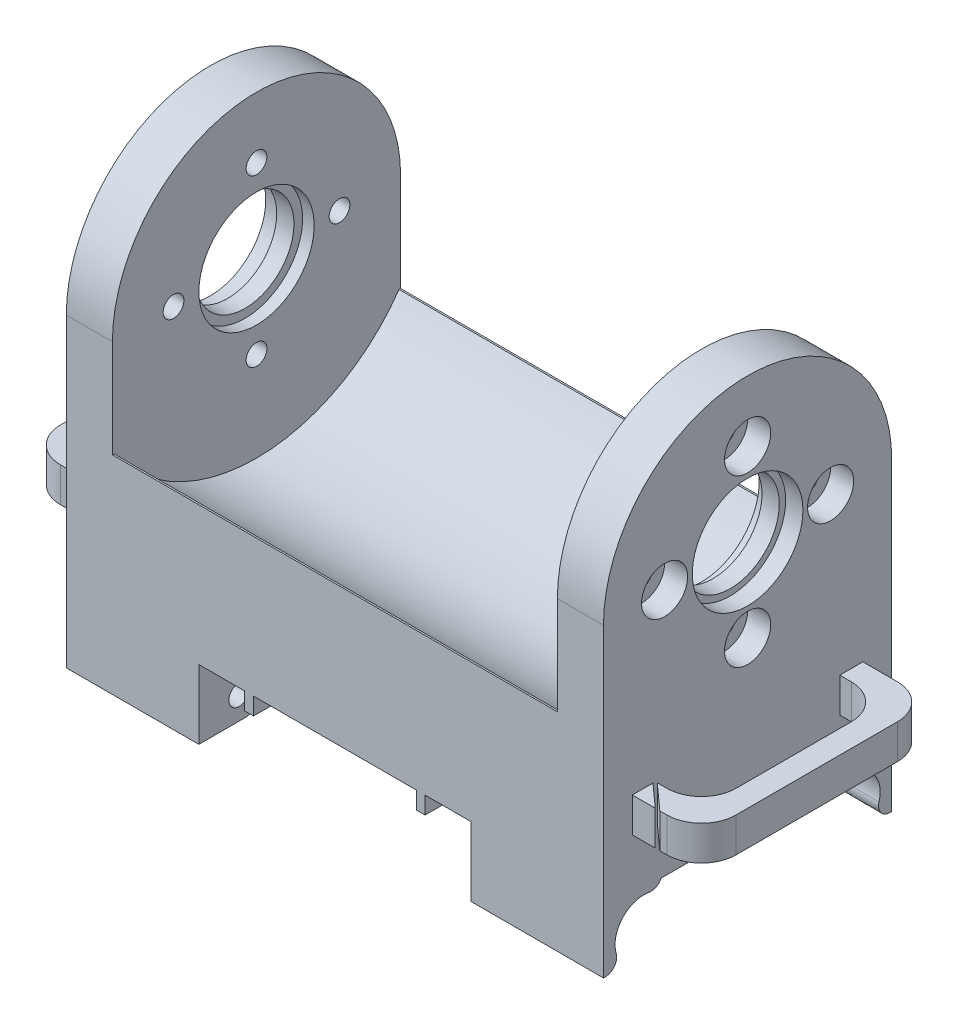
from build123d import *

# Parameters (mm, degrees)
BOSS_EXTRUDE1_DEPTH     = 4
SKETCH3_W               = 25
SKETCH3_H               = 12
BOSS_EXTRUDE2_DEPTH     = 19.3
FILLET1_RADIUS          = 12.5
FILLET1_LENGTH          = 4
CUT_EXTRUDE1_REACH      = 38.232
SKETCH4_R               = 15
CUT_EXTRUDE2_REACH      = 40.512
SKETCH5_R               = 4.25
SKETCH6_R               = 4.8
CUT_EXTRUDE3_DEPTH      = 1.5
SKETCH7_R               = 5
CUT_EXTRUDE4_DEPTH      = 1
CUT_EXTRUDE5_REACH      = 40.512
SKETCH8_R               = 0.9
CIRPATTERN1_COUNT       = 4
SKETCH10_R              = 2
CUT_EXTRUDE6_DEPTH      = 2
CIRPATTERN2_COUNT       = 4
CUT_EXTRUDE7_DEPTH      = 39.511556707
CUT_EXTRUDE7_DEPTH_BACK = 39.511556707
SKETCH11_R              = 0.9
SKETCH12_R              = 2.5
CUT_EXTRUDE8_DEPTH      = 11.5
SKETCH13_W              = 0.761046754
SKETCH13_H              = 25
BOSS_EXTRUDE3_DEPTH     = 1.5
SKETCH14_W              = 20
SKETCH14_H              = 3
BOSS_EXTRUDE4_DEPTH     = 6
FILLET4_R               = 3
SKETCH15_W              = 4
SKETCH15_H              = 16
CUT_EXTRUDE9_DEPTH      = 5
FILLET5_R               = 3
CUT_EXTRUDE10_DEPTH     = 5
SKETCH19_W              = 7.5
SKETCH19_H              = 25
BOSS_EXTRUDE5_DEPTH     = 6
SKETCH21_R              = 0.9
CUT_EXTRUDE11_DEPTH     = 58.464858827
SKETCH22_W              = 15
SKETCH22_H              = 5
CUT_EXTRUDE12_DEPTH     = 58.464858827
SKETCH23_R              = 2.5
CUT_EXTRUDE13_DEPTH     = 6
SKETCH24_R              = 2.5
CUT_EXTRUDE14_DEPTH     = 6
FILLET6_START           = -44
FILLET6_DEPTH           = 11.4
FILLET6_START_2         = -6
FILLET6_2_DEPTH         = 11
FILLET6_START_3         = -32.6
FILLET6_3_DEPTH         = 26.6


with BuildPart() as part:
    # Boss-Extrude1: read off the stored shape, not the designer's step
    # Boss-Extrude1 outline → Boss-Extrude1 (new body)
    with BuildSketch(Plane(origin=(0, 0, 0), x_dir=(0, 0, -1), z_dir=(1, 0, 0))):
        Polygon((-12.5, 28), (-12.5, -11), (-7.5, -11), (-7.5, -6), (7.5, -6), (7.5, -11), (12.5, -11), (12.5, 28), align=None)
    extrude(amount=BOSS_EXTRUDE1_DEPTH)

    # Sketch3 → Boss-Extrude2 (add)
    with BuildSketch(Plane.ZY):
        with Locations((0, 1)):
            Rectangle(SKETCH3_W, SKETCH3_H)
    extrude(amount=BOSS_EXTRUDE2_DEPTH)

    # Fillet1: full round fillet: the end face becomes a half cylinder, R = half its width
    fillet1_face = Plane((2, 28, 0), x_dir=(1, 0, 0), z_dir=(0, 1, 0))  # on the end face: x along it, z out of the body
    fillet1_slab = fillet1_face.offset(-FILLET1_RADIUS / 2) * Box(FILLET1_LENGTH, 2 * FILLET1_RADIUS, FILLET1_RADIUS, mode=Mode.PRIVATE)  # the body's end, R deep
    fillet1_round = Plane((2, 15.5, 0), x_dir=(0, 1, 0), z_dir=(1, 0, 0)) * Cylinder(FILLET1_RADIUS, FILLET1_LENGTH, mode=Mode.PRIVATE)  # its axis R under the face
    add(fillet1_slab - fillet1_round, mode=Mode.SUBTRACT)

    # Sketch4 → Cut-Extrude1 (cut, up to next)
    with BuildSketch(Plane.ZY, mode=Mode.PRIVATE) as cut_extrude1_sk1:
        with Locations((0, 15.5)):
            Circle(SKETCH4_R)
    cut_extrude1_tool1 = extrude(cut_extrude1_sk1.sketch, amount=CUT_EXTRUDE1_REACH, mode=Mode.PRIVATE) & part.part
    add(cut_extrude1_tool1.solids().sort_by_distance((0, 15.5, 0))[0], mode=Mode.SUBTRACT)

    # Sketch5 → Cut-Extrude2 (cut, up to next)
    with BuildSketch(Plane(origin=(4, 0, 0), x_dir=(0, 0, -1), z_dir=(1, 0, 0)), mode=Mode.PRIVATE) as cut_extrude2_sk1:
        with Locations((0, 15.5)):
            Circle(SKETCH5_R)
    cut_extrude2_tool1 = extrude(cut_extrude2_sk1.sketch, amount=-CUT_EXTRUDE2_REACH, mode=Mode.PRIVATE) & part.part
    add(cut_extrude2_tool1.solids().sort_by_distance((4, 15.5, 0))[0], mode=Mode.SUBTRACT)

    # Sketch6 → Cut-Extrude3 (cut)
    with BuildSketch(Plane(origin=(4, 0, 0), x_dir=(0, 0, -1), z_dir=(1, 0, 0))):
        with Locations((0, 15.5)):
            Circle(SKETCH6_R)
    extrude(amount=-CUT_EXTRUDE3_DEPTH, mode=Mode.SUBTRACT)

    # Sketch7 → Cut-Extrude4 (cut)
    with BuildSketch(Plane.ZY):
        with Locations((0, 15.5)):
            Circle(SKETCH7_R)
    extrude(amount=-CUT_EXTRUDE4_DEPTH, mode=Mode.SUBTRACT)

    # Sketch8 → Cut-Extrude5 (cut, up to next)
    with BuildSketch(Plane(origin=(4, 0, 0), x_dir=(0, 0, -1), z_dir=(1, 0, 0)), mode=Mode.PRIVATE) as cut_extrude5_sk1:
        with Locations((0, 22.7)):
            Circle(SKETCH8_R)
    cut_extrude5_tool1 = extrude(cut_extrude5_sk1.sketch, amount=-CUT_EXTRUDE5_REACH, mode=Mode.PRIVATE) & part.part
    cut_extrude5 = cut_extrude5_tool1.solids().sort_by_distance((4, 22.7, 0))[0]
    add(cut_extrude5, mode=Mode.SUBTRACT)

    # CirPattern1: Cut-Extrude5 ×4 about axis
    cirpattern1_axis = Axis((0, 15.5, 0), (1, 0, 0))
    for i in range(1, CIRPATTERN1_COUNT):
        add(cut_extrude5.rotate(cirpattern1_axis, i * 360 / CIRPATTERN1_COUNT), mode=Mode.SUBTRACT)

    # Sketch10 → Cut-Extrude6 (cut)
    with BuildSketch(Plane(origin=(4, 0, 0), x_dir=(0, 0, -1), z_dir=(1, 0, 0))):
        with Locations((0, 22.7)):
            Circle(SKETCH10_R)
    cut_extrude6 = extrude(amount=-CUT_EXTRUDE6_DEPTH, mode=Mode.SUBTRACT)

    # CirPattern2: Cut-Extrude6 ×4 about axis
    cirpattern2_axis = Axis((0, 15.5, 0), (1, 0, 0))
    for i in range(1, CIRPATTERN2_COUNT):
        add(cut_extrude6.rotate(cirpattern2_axis, i * 360 / CIRPATTERN2_COUNT), mode=Mode.SUBTRACT)

    # Sketch11 → Cut-Extrude7 (cut, two sides: drawn at the far end of the back side and taken through both)
    with BuildSketch(Plane(origin=(4, 0, 0), x_dir=(0, 0, -1), z_dir=(1, 0, 0)).offset(-CUT_EXTRUDE7_DEPTH_BACK)):
        with Locations((-9, -9)):
            Circle(SKETCH11_R)
        with Locations((9, -9)):
            Circle(SKETCH11_R)
    extrude(amount=CUT_EXTRUDE7_DEPTH + CUT_EXTRUDE7_DEPTH_BACK, mode=Mode.SUBTRACT)

    # Sketch12 → Cut-Extrude8 (cut)
    with BuildSketch(Plane(origin=(4, 0, 0), x_dir=(0, 0, -1), z_dir=(1, 0, 0))):
        with Locations((-9, -9)):
            Circle(SKETCH12_R)
        with Locations((9, -9)):
            Circle(SKETCH12_R)
    extrude(amount=-CUT_EXTRUDE8_DEPTH, mode=Mode.SUBTRACT)

    # Sketch13 → Boss-Extrude3 (add)
    with BuildSketch(Plane.XZ.offset(5)):
        with Locations((-11.859587158, 0)):
            Rectangle(SKETCH13_W, SKETCH13_H)
    extrude(amount=BOSS_EXTRUDE3_DEPTH)

    # Sketch14 → Boss-Extrude4 (add)
    with BuildSketch(Plane(origin=(4, 0, 0), x_dir=(0, 0, -1), z_dir=(1, 0, 0))):
        Rectangle(SKETCH14_W, SKETCH14_H)
    extrude(amount=BOSS_EXTRUDE4_DEPTH)

    # Fillet4
    fillet4_edges = [part.edges().sort_by_distance(p)[0] for p in [
        (10, 0, 10),
        (10, 0, -10),
    ]]
    fillet(fillet4_edges, radius=FILLET4_R)

    # Sketch15 → Cut-Extrude9 (cut)
    with BuildSketch(Plane(origin=(0, -1.5, 0), x_dir=(-1, 0, 0), z_dir=(0, -1, 0))):
        with Locations((-6, 0)):
            Rectangle(SKETCH15_W, SKETCH15_H)
    extrude(amount=-CUT_EXTRUDE9_DEPTH, mode=Mode.SUBTRACT)

    # Fillet5
    fillet5_edges = [part.edges().sort_by_distance(p)[0] for p in [
        (8, 0, 8),
        (8, 0, -8),
    ]]
    fillet(fillet5_edges, radius=FILLET5_R)

    # Sketch16 → Cut-Extrude10 (cut)
    with BuildSketch(Plane(origin=(0, -1.5, 0), x_dir=(-1, 0, 0), z_dir=(0, -1, 0))):
        Polygon((-4, -8.205789338), (-5.989175581, -10), (-6.38377714, -10), (-4.166450464, -8), (-4, -8), align=None)
    extrude(amount=-CUT_EXTRUDE10_DEPTH, mode=Mode.SUBTRACT)

    # Mirror2: part across plane


with BuildPart() as part_1:
    add(part.part)
    add(part.part.mirror(Plane(origin=(-19.3, 0, 0), x_dir=(0, 0, 1), z_dir=(1, 0, 0))))

    # Sketch19 → Boss-Extrude5 (add)
    with BuildSketch(Plane.XZ.offset(5)):
        with Locations((-3.75, 0)):
            Rectangle(SKETCH19_W, SKETCH19_H)
        with Locations((-34.85, 0)):
            Rectangle(SKETCH19_W, SKETCH19_H)
    extrude(amount=BOSS_EXTRUDE5_DEPTH)

    # Sketch21 → Cut-Extrude11 (cut, through all)
    with BuildSketch(Plane(origin=(0, 0, 0), x_dir=(0, 0, -1), z_dir=(1, 0, 0))):
        with Locations((9, -9)):
            Circle(SKETCH21_R)
        with Locations((-9, -9)):
            Circle(SKETCH21_R)
    extrude(amount=-CUT_EXTRUDE11_DEPTH, mode=Mode.SUBTRACT)

    # Sketch22 → Cut-Extrude12 (cut, through all)
    with BuildSketch(Plane(origin=(0, 0, 0), x_dir=(0, 0, -1), z_dir=(1, 0, 0))):
        with Locations((0, -8.5)):
            Rectangle(SKETCH22_W, SKETCH22_H)
    extrude(amount=-CUT_EXTRUDE12_DEPTH, mode=Mode.SUBTRACT)

    # Sketch23 → Cut-Extrude13 (cut)
    with BuildSketch(Plane(origin=(0, 0, 0), x_dir=(0, 0, -1), z_dir=(1, 0, 0))):
        with Locations((9, -9)):
            Circle(SKETCH23_R)
        with Locations((-9, -9)):
            Circle(SKETCH23_R)
    extrude(amount=-CUT_EXTRUDE13_DEPTH, mode=Mode.SUBTRACT)

    # Sketch24 → Cut-Extrude14 (cut)
    with BuildSketch(Plane.ZY.offset(38.6)):
        with Locations((9, -9)):
            Circle(SKETCH24_R)
        with Locations((-9, -9)):
            Circle(SKETCH24_R)
    extrude(amount=-CUT_EXTRUDE14_DEPTH, mode=Mode.SUBTRACT)

    # Fillet6: read off the stored shape, not the designer's step
    # Fillet6 outline → Fillet6 (cut)
    with BuildSketch(Plane.YZ.offset(FILLET6_START)):
        with BuildLine():
            ThreePointArc((-11, 10.5), (-10.429141482, 11.051232465), (-9.714285714, 11.395787119))
            add(Edge.make_bspline(
                [(-9.714285714, 11.395787119), (-11, 11.01246118), (-11, 12.354101966)],
                knots=[0, 0, 0, 1, 1, 1], degree=2, weights=[1, 0.597614305, 1]))
            Line((-11, 12.354101966), (-11, 10.5))
        make_face()
        with BuildLine():
            add(Edge.make_bspline(
                [(-6, 7.5), (-6.666666667, 7.833333333), (-6.537704575, 8.567447994)],
                knots=[0, 0, 0, 1, 1, 1], degree=2, weights=[1, 0.801783726, 1]))
            ThreePointArc((-6.537704575, 8.567447994), (-6.705902918, 8.006461586), (-7, 7.5))
            Line((-7, 7.5), (-6, 7.5))
        make_face()
        with BuildLine():
            ThreePointArc((-7, -7.5), (-6.705902918, -8.006461586), (-6.537704575, -8.567447994))
            add(Edge.make_bspline(
                [(-6.537704575, -8.567447994), (-6.666666667, -7.833333333), (-6, -7.5)],
                knots=[0, 0, 0, 1, 1, 1], degree=2, weights=[1, 0.801783726, 1]))
            Line((-6, -7.5), (-7, -7.5))
        make_face()
        with BuildLine():
            add(Edge.make_bspline(
                [(-11, -12.354101966), (-11, -11.01246118), (-9.714285714, -11.395787119)],
                knots=[0, 0, 0, 1, 1, 1], degree=2, weights=[1, 0.597614305, 1]))
            ThreePointArc((-9.714285714, -11.395787119), (-10.429141482, -11.051232465), (-11, -10.5))
            Line((-11, -10.5), (-11, -12.354101966))
        make_face()
    extrude(amount=FILLET6_DEPTH, mode=Mode.SUBTRACT)

    # Fillet6 2 outline → Fillet6 2 (cut)
    with BuildSketch(Plane.YZ.offset(FILLET6_START_2)):
        with BuildLine():
            ThreePointArc((-11, 10.5), (-10.429141482, 11.051232465), (-9.714285714, 11.395787119))
            add(Edge.make_bspline(
                [(-9.714285714, 11.395787119), (-11, 11.01246118), (-11, 12.354101966)],
                knots=[0, 0, 0, 1, 1, 1], degree=2, weights=[1, 0.597614305, 1]))
            Line((-11, 12.354101966), (-11, 10.5))
        make_face()
        with BuildLine():
            add(Edge.make_bspline(
                [(-6, 7.5), (-6.666666667, 7.833333333), (-6.537704575, 8.567447994)],
                knots=[0, 0, 0, 1, 1, 1], degree=2, weights=[1, 0.801783726, 1]))
            ThreePointArc((-6.537704575, 8.567447994), (-6.705902918, 8.006461586), (-7, 7.5))
            Line((-7, 7.5), (-6, 7.5))
        make_face()
        with BuildLine():
            ThreePointArc((-7, -7.5), (-6.705902918, -8.006461586), (-6.537704575, -8.567447994))
            add(Edge.make_bspline(
                [(-6.537704575, -8.567447994), (-6.666666667, -7.833333333), (-6, -7.5)],
                knots=[0, 0, 0, 1, 1, 1], degree=2, weights=[1, 0.801783726, 1]))
            Line((-6, -7.5), (-7, -7.5))
        make_face()
        with BuildLine():
            add(Edge.make_bspline(
                [(-11, -12.354101966), (-11, -11.01246118), (-9.714285714, -11.395787119)],
                knots=[0, 0, 0, 1, 1, 1], degree=2, weights=[1, 0.597614305, 1]))
            ThreePointArc((-9.714285714, -11.395787119), (-10.429141482, -11.051232465), (-11, -10.5))
            Line((-11, -10.5), (-11, -12.354101966))
        make_face()
    extrude(amount=FILLET6_2_DEPTH, mode=Mode.SUBTRACT)

    # Fillet6 3 outline → Fillet6 3 (cut)
    with BuildSketch(Plane.YZ.offset(FILLET6_START_3)):
        with BuildLine():
            add(Edge.make_bspline(
                [(-11, 8.5), (-11, 7.5), (-10, 7.5)],
                knots=[0, 0, 0, 1, 1, 1], degree=2, weights=[1, 0.707106781, 1]))
            Line((-11, 8.5), (-11, 7.5))
            Line((-11, 7.5), (-10, 7.5))
        make_face()
        with BuildLine():
            add(Edge.make_bspline(
                [(-10, -7.5), (-11, -7.5), (-11, -8.5)],
                knots=[0, 0, 0, 1, 1, 1], degree=2, weights=[1, 0.707106781, 1]))
            Line((-10, -7.5), (-11, -7.5))
            Line((-11, -7.5), (-11, -8.5))
        make_face()
    extrude(amount=FILLET6_3_DEPTH, mode=Mode.SUBTRACT)


solid = part_1.part
